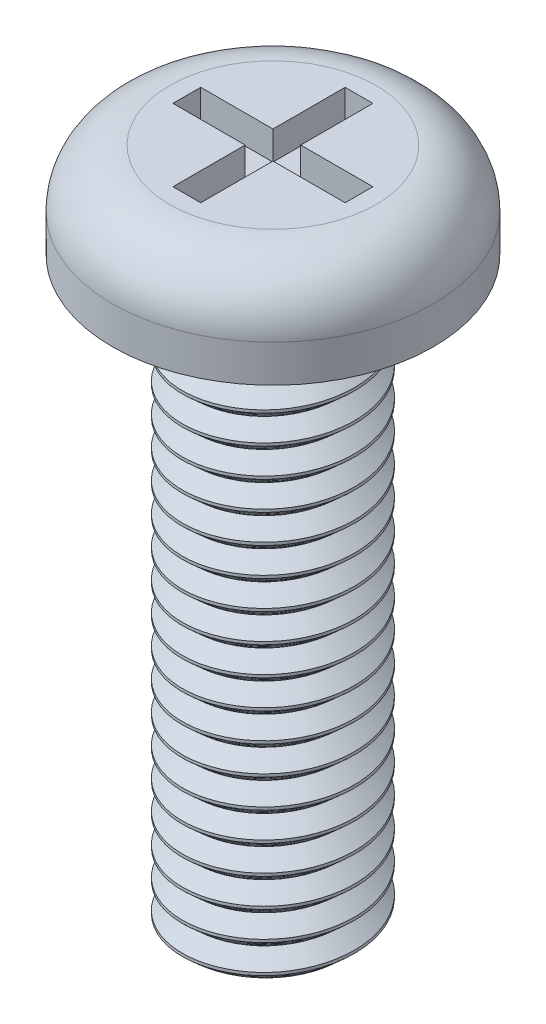
from build123d import *

# Parameters (mm, degrees)
SKETCH1_R           = 2.8
BOSS_EXTRUDE1_DEPTH = 1.65
CUT_EXTRUDE1_DEPTH  = 0.5
FILLET1_R           = 1
SKETCH3_R           = 1.5
BOSS_EXTRUDE2_DEPTH = 10
CUT_SWEEP1_PITCH    = 0.5
CUT_SWEEP1_TO       = 10


with BuildPart() as part:
    # Sketch1 → Boss-Extrude1 (new body)
    with BuildSketch(Plane(origin=(0, 0, 0), x_dir=(1, 0, 0), z_dir=(0, 1, 0))):
        with Locations(Location((0, 0, 0), (0, 0, 270))):
            Circle(SKETCH1_R)
    extrude(amount=BOSS_EXTRUDE1_DEPTH)

    # Sketch2 → Cut-Extrude1 (cut)
    with BuildSketch(Plane(origin=(0, 1.65, 0), x_dir=(1, 0, 0), z_dir=(0, 1, 0))):
        Polygon((-1.502022441, 0.242327465), (-1.502022441, -0.242327465), (-0.242327465, -0.242327465), (-0.242327465, -1.502022441), (0.242327465, -1.502022441), (0.242327465, -0.242327465), (1.502022441, -0.242327465), (1.502022441, 0.242327465), (0.242327465, 0.242327465), (0.242327465, 1.502022441), (-0.242327465, 1.502022441), (-0.242327465, 0.242327465), align=None)
    extrude(amount=-CUT_EXTRUDE1_DEPTH, mode=Mode.SUBTRACT)

    # Fillet1
    fillet1_edges = [part.edges().sort_by_distance(p)[0] for p in [
        (0, 1.65, -2.8),
    ]]
    fillet(fillet1_edges, radius=FILLET1_R)

    # Sketch3 → Boss-Extrude2 (add)
    with BuildSketch(Plane(origin=(0, 0, 0), x_dir=(1, 0, 0), z_dir=(0, 1, 0))):
        with Locations(Location((0, 0, 0), (0, 0, 270))):
            Circle(SKETCH3_R)
    extrude(amount=-BOSS_EXTRUDE2_DEPTH)

    # Cut-Sweep1: arcs per turn and ends read off the stored shape
    # Cut-Sweep1: the profile of Sketch4 profile screwed along a right-hand helix through 21.666667 turns, 6 arcs to a turn; built about Z, then put on its axis
    cut_sweep1_z = Axis((0, 0, 0), (0, 0, 1))
    cut_sweep1_corners = [(1.25, 0, -0.5), (1.5003, 0, -0.27473), (1.5003, 0, -0.72527)]
    with BuildLine(mode=Mode.PRIVATE) as cut_sweep1_profile:
        Line(cut_sweep1_corners[0], cut_sweep1_corners[1])
        Line(cut_sweep1_corners[1], cut_sweep1_corners[2])
        Line(cut_sweep1_corners[2], cut_sweep1_corners[0])
    cut_sweep1_cap = Face(cut_sweep1_profile.wire())
    cut_sweep1_turn_angles = [0, 30, 60, 90, 120, 150, 180, 210, 240, 270, 300, 330, 360]
    cut_sweep1_turn_weights = [1, 0.8660254037844387, 1, 0.8660254037844387, 1, 0.8660254037844387, 1, 0.8660254037844387, 1, 0.8660254037844387, 1, 0.8660254037844387, 1]
    cut_sweep1_turn_rails = [Edge.make_bspline([Vector(p[0], p[1], 0).rotate(cut_sweep1_z, cut_sweep1_turn_angles[k]) / cut_sweep1_turn_weights[k] + Vector(0, 0, p[2] + CUT_SWEEP1_PITCH * cut_sweep1_turn_angles[k] / 360) for k in range(13)], [0, 0, 0, 1, 1, 2, 2, 3, 3, 4, 4, 5, 5, 6, 6, 6], 2, cut_sweep1_turn_weights) for p in cut_sweep1_corners]
    cut_sweep1_turn_sides = [Face.make_surface_from_curves(cut_sweep1_turn_rails[p[0]], cut_sweep1_turn_rails[p[1]]) for p in [(0, 1), (1, 2), (2, 0)]]
    cut_sweep1_last_angles = [7560, 7590, 7620, 7650, 7680, 7710, 7740, 7770, 7800]
    cut_sweep1_last_weights = [1, 0.8660254037844387, 1, 0.8660254037844387, 1, 0.8660254037844387, 1, 0.8660254037844387, 1]
    cut_sweep1_last_rails = [Edge.make_bspline([Vector(p[0], p[1], 0).rotate(cut_sweep1_z, cut_sweep1_last_angles[k]) / cut_sweep1_last_weights[k] + Vector(0, 0, p[2] + CUT_SWEEP1_PITCH * cut_sweep1_last_angles[k] / 360) for k in range(9)], [0, 0, 0, 1, 1, 2, 2, 3, 3, 4, 4, 4], 2, cut_sweep1_last_weights) for p in cut_sweep1_corners]
    cut_sweep1_last_sides = [Face.make_surface_from_curves(cut_sweep1_last_rails[p[0]], cut_sweep1_last_rails[p[1]]) for p in [(0, 1), (1, 2), (2, 0)]]
    cut_sweep1 = Plane(origin=(0, -10, 0), x_dir=(1, 0, 0), z_dir=(0, 1, 0)) * split(Solid(Shell([*[p.moved(Location((0, 0, CUT_SWEEP1_PITCH * i))) for i in range(21) for p in cut_sweep1_turn_sides], *cut_sweep1_last_sides, cut_sweep1_cap, cut_sweep1_cap.rotate(cut_sweep1_z, 7800).moved(Location((0, 0, CUT_SWEEP1_PITCH * 7800 / 360)))])), bisect_by=Plane.XY.offset(CUT_SWEEP1_TO), keep=Keep.BOTTOM, mode=Mode.PRIVATE)
    add(cut_sweep1, mode=Mode.SUBTRACT)


solid = part.part
